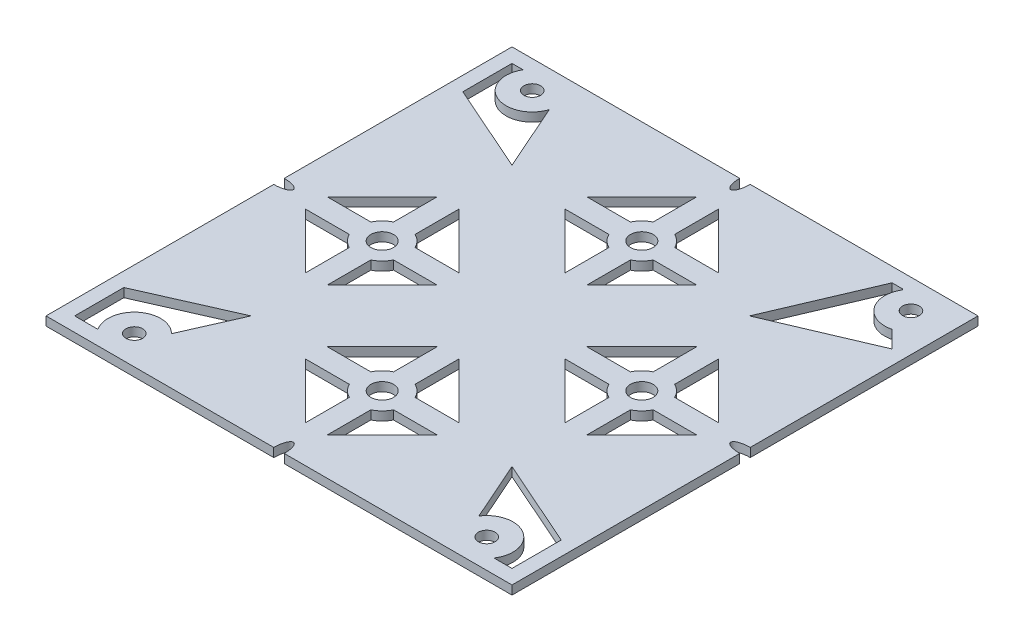
from build123d import *

# Parameters (mm, degrees)
SKETCH1_W           = 97.6
SKETCH1_H           = 97.6
BOSS_EXTRUDE1_DEPTH = 1.85
SKETCH3_R           = 1.25
CUT_EXTRUDE1_DEPTH  = 10
FILLET1_R           = 0.2
SKETCH5_R           = 2.375
CUT_EXTRUDE2_DEPTH  = 10
SKETCH6_R           = 1.75
CUT_EXTRUDE3_DEPTH  = 139.039641188


with BuildPart() as part:
    # Sketch1 → Boss-Extrude1 (new body)
    with BuildSketch(Plane(origin=(0, 0, 0), x_dir=(1, 0, 0), z_dir=(0, 1, 0))):
        with Locations((48.8, 48.8)):
            Rectangle(SKETCH1_W, SKETCH1_H)
    extrude(amount=BOSS_EXTRUDE1_DEPTH)

    # Sketch3 → Cut-Extrude1 (cut)
    with BuildSketch(Plane.XZ):
        with BuildLine():
            Line((3, -84.3), (3, -94.6))
            Line((3, -94.6), (5.316079849, -94.6))
            ThreePointArc((5.316079849, -94.6), (7.792729855, -86.784550719), (15.285000001, -90.113353923))
            Line((15.285000001, -90.113353923), (21.472818771, -76.127181229))
            Line((21.472818771, -76.127181229), (3, -84.3))
        make_face()
        with BuildLine():
            Line((3, -13.3), (21.472818771, -21.472818771))
            Line((21.472818771, -21.472818771), (16.360495139, -9.917560959))
            ThreePointArc((16.360495139, -9.917560959), (8.975209709, -10.313312378), (7.873156109, -3))
            Line((7.873156109, -3), (3, -3))
            Line((3, -3), (3, -13.3))
        make_face()
        with BuildLine():
            Line((94.6, -13.3), (94.6, -3))
            Line((94.6, -3), (90.826843891, -3))
            ThreePointArc((90.826843891, -3), (89.267333256, -10.648445392), (81.630186258, -9.034513526))
            Line((81.630186258, -9.034513526), (76.127181229, -21.472818771))
            Line((76.127181229, -21.472818771), (94.6, -13.3))
        make_face()
        with BuildLine():
            Line((91.027327292, -86.172672708), (94.6, -82.6))
            Line((94.6, -82.6), (73.674141566, -73.674141566))
            Line((73.674141566, -73.674141566), (82.6, -94.6))
            Line((82.6, -94.6), (85.116873323, -94.6))
            ThreePointArc((85.116873323, -94.6), (85.157069093, -88.341897208), (91.027327292, -86.172672708))
        make_face()
        with Locations((89.66, -91.5)):
            Circle(SKETCH3_R)
        with Locations((10.05, -91.8)):
            Circle(SKETCH3_R)
        with Locations((12.45, -6.05)):
            Circle(SKETCH3_R)
        with Locations((86.25, -6.05)):
            Circle(SKETCH3_R)
    extrude(amount=-CUT_EXTRUDE1_DEPTH, mode=Mode.SUBTRACT)

    # Fillet1
    fillet1_edges = [part.edges().sort_by_distance(p)[0] for p in [
        (85.116873323, 0.925, -94.6),
    ]]
    fillet(fillet1_edges, radius=FILLET1_R)

    # Sketch5 → Cut-Extrude2 (cut)
    with BuildSketch(Plane.XZ):
        with BuildLine():
            Line((51.05, -80.617052601), (51.05, -89.767052601))
            Line((51.05, -89.767052601), (62.582493929, -78.234558673))
            Line((62.582493929, -78.234558673), (53.432493929, -78.234558673))
            ThreePointArc((53.432493929, -78.234558673), (52.441599923, -79.626158596), (51.05, -80.617052601))
        make_face()
        with BuildLine():
            Line((46.55, -89.767052601), (46.55, -80.617052601))
            ThreePointArc((46.55, -80.617052601), (45.158400077, -79.626158596), (44.167506071, -78.234558673))
            Line((44.167506071, -78.234558673), (35.017506071, -78.234558673))
            Line((35.017506071, -78.234558673), (46.55, -89.767052601))
        make_face()
        with BuildLine():
            Line((35.017506071, -73.734558673), (44.167506071, -73.734558673))
            ThreePointArc((44.167506071, -73.734558673), (45.158400077, -72.34295875), (46.55, -71.352064744))
            Line((46.55, -71.352064744), (46.55, -62.202064744))
            Line((46.55, -62.202064744), (35.017506071, -73.734558673))
        make_face()
        with BuildLine():
            ThreePointArc((51.05, -71.352064744), (52.441599923, -72.34295875), (53.432493929, -73.734558673))
            Line((53.432493929, -73.734558673), (62.582493929, -73.734558673))
            Line((62.582493929, -73.734558673), (51.05, -62.202064744))
            Line((51.05, -62.202064744), (51.05, -71.352064744))
        make_face()
        with BuildLine():
            Line((73.734558673, -35.017506071), (62.202064744, -46.55))
            Line((62.202064744, -46.55), (71.352064744, -46.55))
            ThreePointArc((71.352064744, -46.55), (72.34295875, -45.158400077), (73.734558673, -44.167506071))
            Line((73.734558673, -44.167506071), (73.734558673, -35.017506071))
        make_face()
        with BuildLine():
            ThreePointArc((73.734558673, -53.432493929), (72.34295875, -52.441599923), (71.352064744, -51.05))
            Line((71.352064744, -51.05), (62.202064744, -51.05))
            Line((62.202064744, -51.05), (73.734558673, -62.582493929))
            Line((73.734558673, -62.582493929), (73.734558673, -53.432493929))
        make_face()
        with BuildLine():
            Line((78.234558673, -35.017506071), (78.234558673, -44.167506071))
            ThreePointArc((78.234558673, -44.167506071), (79.626158596, -45.158400077), (80.617052601, -46.55))
            Line((80.617052601, -46.55), (89.767052601, -46.55))
            Line((89.767052601, -46.55), (78.234558673, -35.017506071))
        make_face()
        with BuildLine():
            ThreePointArc((80.617052601, -51.05), (79.626158596, -52.441599923), (78.234558673, -53.432493929))
            Line((78.234558673, -53.432493929), (78.234558673, -62.582493929))
            Line((78.234558673, -62.582493929), (89.767052601, -51.05))
            Line((89.767052601, -51.05), (80.617052601, -51.05))
        make_face()
        with BuildLine():
            Line((46.55, -16.982947399), (46.55, -7.832947399))
            Line((46.55, -7.832947399), (35.017506071, -19.365441327))
            Line((35.017506071, -19.365441327), (44.167506071, -19.365441327))
            ThreePointArc((44.167506071, -19.365441327), (45.158400077, -17.973841404), (46.55, -16.982947399))
        make_face()
        with BuildLine():
            Line((51.05, -7.832947399), (51.05, -16.982947399))
            ThreePointArc((51.05, -16.982947399), (52.441599923, -17.973841404), (53.432493929, -19.365441327))
            Line((53.432493929, -19.365441327), (62.582493929, -19.365441327))
            Line((62.582493929, -19.365441327), (51.05, -7.832947399))
        make_face()
        with BuildLine():
            ThreePointArc((46.55, -26.247935256), (45.158400077, -25.25704125), (44.167506071, -23.865441327))
            Line((44.167506071, -23.865441327), (35.017506071, -23.865441327))
            Line((35.017506071, -23.865441327), (46.55, -35.397935256))
            Line((46.55, -35.397935256), (46.55, -26.247935256))
        make_face()
        with BuildLine():
            Line((62.582493929, -23.865441327), (53.432493929, -23.865441327))
            ThreePointArc((53.432493929, -23.865441327), (52.441599923, -25.25704125), (51.05, -26.247935256))
            Line((51.05, -26.247935256), (51.05, -35.397935256))
            Line((51.05, -35.397935256), (62.582493929, -23.865441327))
        make_face()
        with BuildLine():
            Line((23.865441327, -62.582493929), (35.397935256, -51.05))
            Line((35.397935256, -51.05), (26.247935256, -51.05))
            ThreePointArc((26.247935256, -51.05), (25.25704125, -52.441599923), (23.865441327, -53.432493929))
            Line((23.865441327, -53.432493929), (23.865441327, -62.582493929))
        make_face()
        with BuildLine():
            Line((19.365441327, -62.582493929), (19.365441327, -53.432493929))
            ThreePointArc((19.365441327, -53.432493929), (17.973841404, -52.441599923), (16.982947399, -51.05))
            Line((16.982947399, -51.05), (7.832947399, -51.05))
            Line((7.832947399, -51.05), (19.365441327, -62.582493929))
        make_face()
        with BuildLine():
            ThreePointArc((23.865441327, -44.167506071), (25.25704125, -45.158400077), (26.247935256, -46.55))
            Line((26.247935256, -46.55), (35.397935256, -46.55))
            Line((35.397935256, -46.55), (23.865441327, -35.017506071))
            Line((23.865441327, -35.017506071), (23.865441327, -44.167506071))
        make_face()
        with BuildLine():
            Line((7.832947399, -46.55), (16.982947399, -46.55))
            ThreePointArc((16.982947399, -46.55), (17.973841404, -45.158400077), (19.365441327, -44.167506071))
            Line((19.365441327, -44.167506071), (19.365441327, -35.017506071))
            Line((19.365441327, -35.017506071), (7.832947399, -46.55))
        make_face()
        with BuildLine():
            Line((47.7, -97.6), (49.9, -97.6))
            add(Edge.make_bspline(
                [(49.9, -97.6), (49.9, -94.604595373), (48.8, -94.604595373)],
                knots=[4.71238898, 4.71238898, 4.71238898, 6.283185307, 6.283185307, 6.283185307], degree=2, weights=[1, 0.707106781, 1]))
            add(Edge.make_bspline(
                [(48.8, -94.604595373), (47.7, -94.604595373), (47.7, -97.6)],
                knots=[0, 0, 0, 1.570796327, 1.570796327, 1.570796327], degree=2, weights=[1, 0.707106781, 1]))
        make_face()
        with BuildLine():
            add(Edge.make_bspline(
                [(94.596161078, -48.8), (94.596161078, -49.9), (97.6, -49.9)],
                knots=[0, 0, 0, 1.570796327, 1.570796327, 1.570796327], degree=2, weights=[1, 0.707106781, 1]))
            Line((97.6, -49.9), (97.6, -47.7))
            add(Edge.make_bspline(
                [(97.6, -47.7), (94.596161078, -47.7), (94.596161078, -48.8)],
                knots=[4.71238898, 4.71238898, 4.71238898, 6.283185307, 6.283185307, 6.283185307], degree=2, weights=[1, 0.707106781, 1]))
        make_face()
        with BuildLine():
            Line((0, -47.7), (0, -49.9))
            add(Edge.make_bspline(
                [(0, -49.9), (3, -49.9), (3, -48.8)],
                knots=[4.71238898, 4.71238898, 4.71238898, 6.283185307, 6.283185307, 6.283185307], degree=2, weights=[1, 0.707106781, 1]))
            add(Edge.make_bspline(
                [(3, -48.8), (3, -47.7), (0, -47.7)],
                knots=[0, 0, 0, 1.570796327, 1.570796327, 1.570796327], degree=2, weights=[1, 0.707106781, 1]))
        make_face()
        with BuildLine():
            add(Edge.make_bspline(
                [(48.8, -3), (49.9, -3), (49.9, 0)],
                knots=[0, 0, 0, 1.570796327, 1.570796327, 1.570796327], degree=2, weights=[1, 0.707106781, 1]))
            Line((49.9, 0), (47.7, 0))
            add(Edge.make_bspline(
                [(47.7, 0), (47.7, -3), (48.8, -3)],
                knots=[4.71238898, 4.71238898, 4.71238898, 6.283185307, 6.283185307, 6.283185307], degree=2, weights=[1, 0.707106781, 1]))
        make_face()
        with Locations((48.8, -75.984558673)):
            Circle(SKETCH5_R)
        with Locations((75.984558673, -48.8)):
            Circle(SKETCH5_R)
        with Locations((48.8, -21.615441327)):
            Circle(SKETCH5_R)
        with Locations((21.615441327, -48.8)):
            Circle(SKETCH5_R)
    extrude(amount=-CUT_EXTRUDE2_DEPTH, mode=Mode.SUBTRACT)

    # Sketch6 → Cut-Extrude3 (cut, through all)
    with BuildSketch(Plane.XZ):
        with Locations((12.45, -6.05)):
            Circle(SKETCH6_R)
        with Locations((86.25, -6.05)):
            Circle(SKETCH6_R)
        with Locations((10.05, -91.8)):
            Circle(SKETCH6_R)
        with Locations((89.66, -91.5)):
            Circle(SKETCH6_R)
    extrude(amount=-CUT_EXTRUDE3_DEPTH, mode=Mode.SUBTRACT)


solid = part.part
